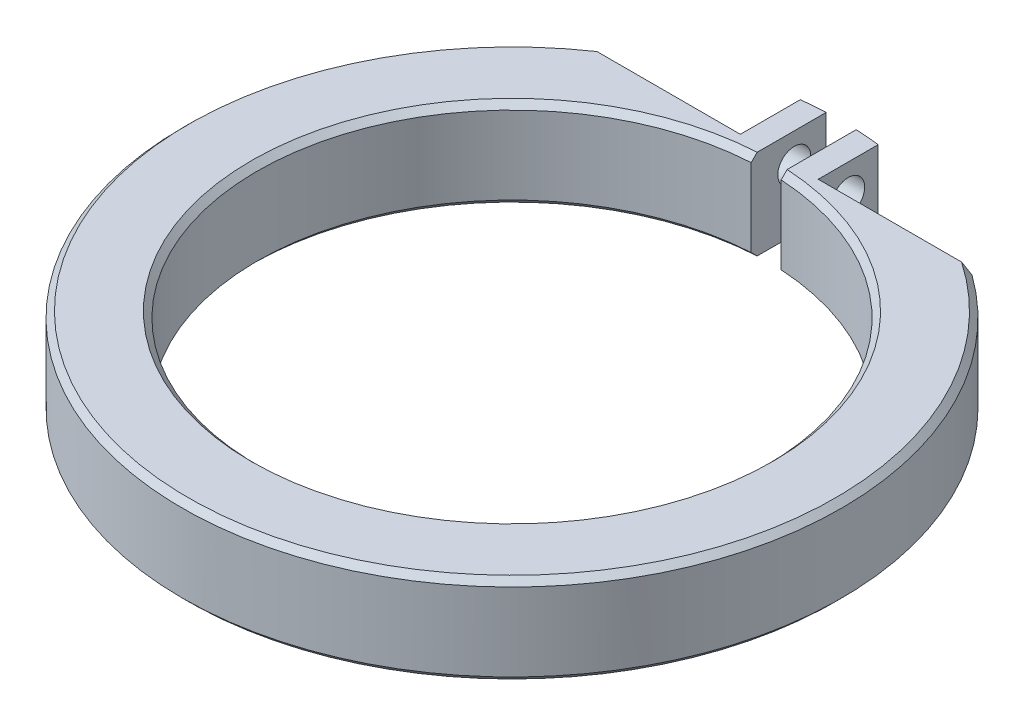
from build123d import *

# Parameters (mm, degrees)
SKETCH1_R           = 55
SKETCH1_R_2         = 42.5
BOSS_EXTRUDE1_DEPTH = 15
CUT_EXTRUDE1_DEPTH  = 80.214897589
CUT_EXTRUDE2_START  = -10
CUT_EXTRUDE2_DEPTH  = 10
SKETCH4_R           = 2.75
CUT_EXTRUDE3_DEPTH  = 84.858511792
FILLET2_R           = 2
CHAMFER2_SIZE       = 1
CHAMFER3_SIZE       = 1


with BuildPart() as part:
    # Sketch1 → Boss-Extrude1 (new body)
    with BuildSketch(Plane(origin=(0, 0, 0), x_dir=(1, 0, 0), z_dir=(0, 1, 0))):
        Circle(SKETCH1_R)
        Circle(SKETCH1_R_2, mode=Mode.SUBTRACT)
    extrude(amount=BOSS_EXTRUDE1_DEPTH)

    # Sketch2 → Cut-Extrude1 (cut, through all)
    with BuildSketch(Plane(origin=(0, 15, 0), x_dir=(1, 0, 0), z_dir=(0, 1, 0))):
        with BuildLine():
            Line((-2.5, 42.426406871), (-2.5, 54.94315244))
            ThreePointArc((-2.5, 54.94315244), (0, 55), (2.5, 54.94315244))
            Line((2.5, 54.94315244), (2.5, 42.426406871))
            ThreePointArc((2.5, 42.426406871), (0, 42.5), (-2.5, 42.426406871))
        make_face()
    extrude(amount=-CUT_EXTRUDE1_DEPTH, mode=Mode.SUBTRACT)

    # Sketch3 → Cut-Extrude2 (cut)
    with BuildSketch(Plane(origin=(0, 15, 0), x_dir=(1, 0, 0), z_dir=(0, 1, 0)).offset(CUT_EXTRUDE2_START)):
        with BuildLine():
            Line((-6.5, 54.614558499), (-6.5, 44.614558499))
            Line((-6.5, 44.614558499), (-32.164284074, 44.614558499))
            ThreePointArc((-32.164284074, 44.614558499), (-19.96826772, 51.247129522), (-6.5, 54.614558499))
        make_face()
        with BuildLine():
            Line((6.5, 44.614558499), (32.164284074, 44.614558499))
            ThreePointArc((32.164284074, 44.614558499), (19.96826772, 51.247129522), (6.5, 54.614558499))
            Line((6.5, 54.614558499), (6.5, 44.614558499))
        make_face()
    extrude(amount=CUT_EXTRUDE2_DEPTH, mode=Mode.SUBTRACT)

    # Sketch4 → Cut-Extrude3 (cut, through all)
    with BuildSketch(Plane.ZY.offset(6.5)):
        with Locations((-49.614558499, 10)):
            Circle(SKETCH4_R)
    extrude(amount=-CUT_EXTRUDE3_DEPTH, mode=Mode.SUBTRACT)

    # Fillet2
    fillet2_edges = [part.edges().sort_by_distance(p)[0] for p in [
        (-19.332142037, 5, -44.614558499),
        (19.332142037, 5, -44.614558499),
    ]]
    fillet(fillet2_edges, radius=FILLET2_R)

    # Chamfer2
    chamfer2_edges = [part.edges().sort_by_distance(p)[0] for p in [
        (0, 15, 55),
        (0, 0, 55),
    ]]
    chamfer(chamfer2_edges, length=CHAMFER2_SIZE)

    # Chamfer3
    chamfer3_edges = [part.edges().sort_by_distance(p)[0] for p in [
        (-29.154759474, 0, 30.923292192),
        (-29.154759474, 15, 30.923292192),
    ]]
    chamfer(chamfer3_edges, length=CHAMFER3_SIZE)


solid = part.part
